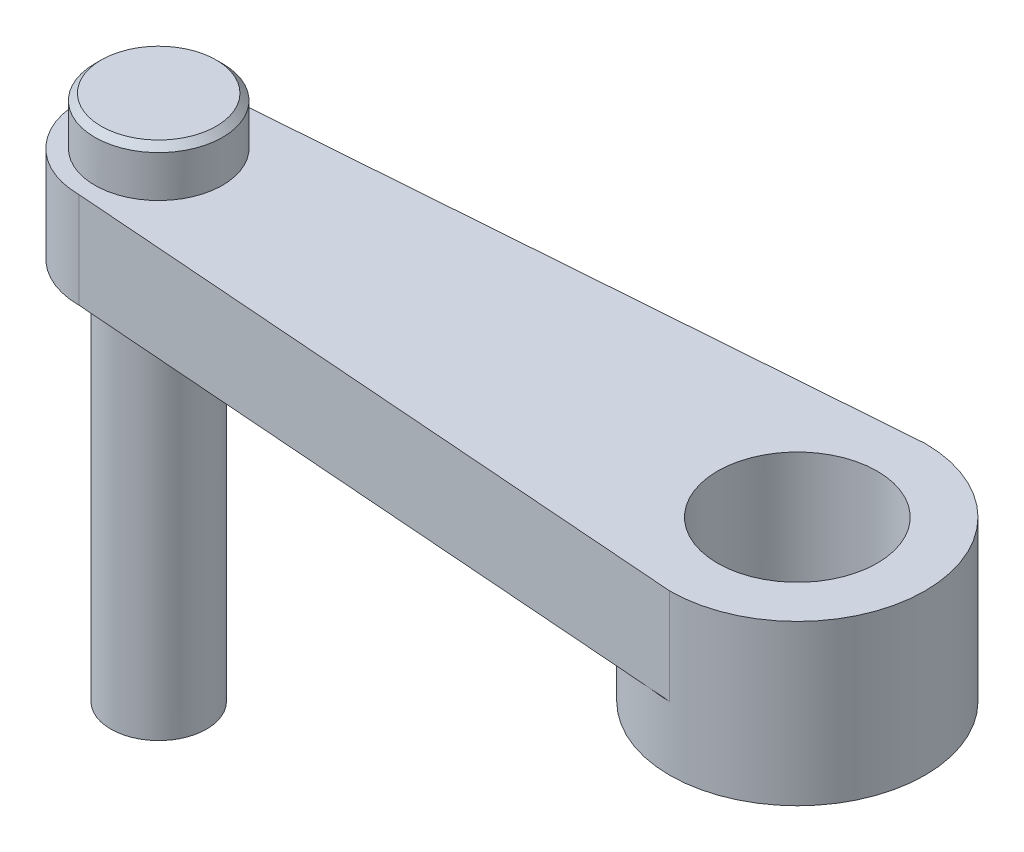
from build123d import *

# Parameters (mm, degrees)
SKETCH3_R           = 1.5
SKETCH3_R_2         = 2.5
BOSS_EXTRUDE1_DEPTH = 3
BOSS_EXTRUDE2_START = 2
SKETCH4_R           = 4
SKETCH4_R_2         = 2.5
BOSS_EXTRUDE2_DEPTH = 2
BOSS_EXTRUDE3_START = -15
SKETCH5_R           = 1.5
BOSS_EXTRUDE3_DEPTH = 15
SKETCH6_R           = 2
BOSS_EXTRUDE4_DEPTH = 1.5
CHAMFER1_SIZE       = 0.2


with BuildPart() as part:
    # Sketch3 → Boss-Extrude1 (new body)
    with BuildSketch(Plane(origin=(0, 0, 0), x_dir=(1, 0, 0), z_dir=(0, 1, 0))):
        with BuildLine():
            Line((0, 0), (20, -1.5))
            ThreePointArc((20, -1.5), (24, 2.5), (20, 6.5))
            Line((20, 6.5), (0, 5))
            ThreePointArc((0, 5), (-2.5, 2.5), (0, 0))
        make_face()
        with Locations((0, 2.5)):
            Circle(SKETCH3_R, mode=Mode.SUBTRACT)
        with Locations((20, 2.5)):
            Circle(SKETCH3_R_2, mode=Mode.SUBTRACT)
    extrude(amount=BOSS_EXTRUDE1_DEPTH)

    # Sketch4 → Boss-Extrude2 (add)
    with BuildSketch(Plane.XZ.offset(BOSS_EXTRUDE2_START)):
        with Locations((20, -2.5)):
            Circle(SKETCH4_R)
        with Locations((20, -2.5)):
            Circle(SKETCH4_R_2, mode=Mode.SUBTRACT)
    extrude(amount=-BOSS_EXTRUDE2_DEPTH)

    # Sketch5 → Boss-Extrude3 (add)
    with BuildSketch(Plane(origin=(0, 3, 0), x_dir=(1, 0, 0), z_dir=(0, 1, 0)).offset(BOSS_EXTRUDE3_START)):
        with Locations((0, 2.5)):
            Circle(SKETCH5_R)
    extrude(amount=BOSS_EXTRUDE3_DEPTH)

    # Sketch6 → Boss-Extrude4 (add)
    with BuildSketch(Plane(origin=(0, 3, 0), x_dir=(1, 0, 0), z_dir=(0, 1, 0))):
        with Locations((0, 2.5)):
            Circle(SKETCH6_R)
    extrude(amount=BOSS_EXTRUDE4_DEPTH)

    # Chamfer1
    chamfer1_edges = [part.edges().sort_by_distance(p)[0] for p in [
        (-2, 4.5, -2.5),
    ]]
    chamfer(chamfer1_edges, length=CHAMFER1_SIZE)


solid = part.part
